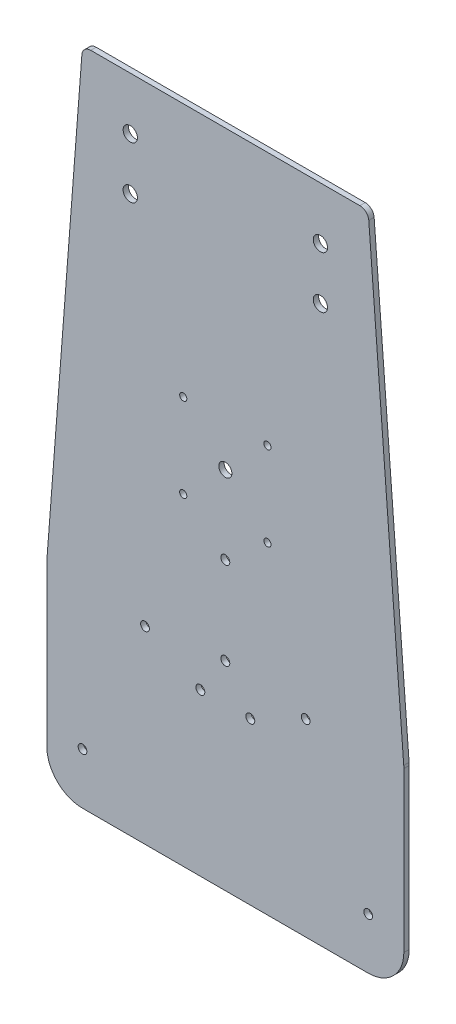
from build123d import *

# Parameters (mm, degrees)
CROQUIS1_R              = 2
CROQUIS1_R_2            = 3.675
CROQUIS1_R_3            = 2.5
CROQUIS1_R_4            = 2.45
CROQUIS1_R_5            = 4
SALIENTE_EXTRUIR1_DEPTH = 3
REDONDEO1_R             = 20
REDONDEO2_R             = 20
REDONDEO3_R             = 5


with BuildPart() as part:
    # Croquis1 → Saliente-Extruir1 (new body)
    with BuildSketch(Plane.XY):
        Polygon((-100, -204.2), (100, -204.2), (100, -94.2), (80, 165.8), (-80, 165.8), (-100, -94.2), align=None)
        with Locations((-23.57, 23.57)):
            Circle(CROQUIS1_R, mode=Mode.SUBTRACT)
        with Locations((23.57, 23.57)):
            Circle(CROQUIS1_R, mode=Mode.SUBTRACT)
        with Locations((-23.57, -23.57)):
            Circle(CROQUIS1_R, mode=Mode.SUBTRACT)
        with Locations((23.57, -23.57)):
            Circle(CROQUIS1_R, mode=Mode.SUBTRACT)
        Circle(CROQUIS1_R_2, mode=Mode.SUBTRACT)
        with Locations((-14, -113.7)):
            Circle(CROQUIS1_R_3, mode=Mode.SUBTRACT)
        with Locations(Location((14, -113.7, 0), (0, 0, 180))):
            Circle(CROQUIS1_R_3, mode=Mode.SUBTRACT)
        with Locations((-45, -98.4)):
            Circle(CROQUIS1_R_4, mode=Mode.SUBTRACT)
        with Locations(Location((45, -98.4, 0), (0, 0, 180))):
            Circle(CROQUIS1_R_4, mode=Mode.SUBTRACT)
        with Locations((-80, -175.5)):
            Circle(CROQUIS1_R_4, mode=Mode.SUBTRACT)
        with Locations(Location((80, -175.5, 0), (0, 0, 180))):
            Circle(CROQUIS1_R_4, mode=Mode.SUBTRACT)
        with Locations((0, -43.7)):
            Circle(CROQUIS1_R_3, mode=Mode.SUBTRACT)
        with Locations((0, -92.7)):
            Circle(CROQUIS1_R_3, mode=Mode.SUBTRACT)
        with Locations((53.25, 136.35)):
            Circle(CROQUIS1_R_5, mode=Mode.SUBTRACT)
        with Locations(Location((53.25, 107.25, 0), (0, 0, 180))):
            Circle(CROQUIS1_R_5, mode=Mode.SUBTRACT)
        with Locations((-53.25, 107.25)):
            Circle(CROQUIS1_R_5, mode=Mode.SUBTRACT)
        with Locations(Location((-53.25, 136.35, 0), (0, 0, 180))):
            Circle(CROQUIS1_R_5, mode=Mode.SUBTRACT)
    extrude(amount=SALIENTE_EXTRUIR1_DEPTH)

    # Redondeo1
    redondeo1_edges = [part.edges().sort_by_distance(p)[0] for p in [
        (100, -204.2, 1.5),
        (-100, -204.2, 1.5),
    ]]
    fillet(redondeo1_edges, radius=REDONDEO1_R)

    # Redondeo2
    # the kernel refuses this fillet: 20 mm, written as the material it takes off along each edge
    with BuildSketch(Plane(origin=(100, -94.2, -1.92024052), x_dir=(0, -1, 0), z_dir=(0, 0, 1))) as redondeo2_piece_1:
        with BuildLine():
            CenterArc((REDONDEO2_R * 0.0384048104053, -REDONDEO2_R), REDONDEO2_R, 90, 4.398705355)
            Line((-REDONDEO2_R * 0.0382916884794, -REDONDEO2_R * 0.00294551449842), (0, 0))
            Line((0, 0), (REDONDEO2_R * 0.0384048104053, 0))
        make_face()
    extrude(amount=6.840481041, mode=Mode.SUBTRACT)
    with BuildSketch(Plane(origin=(-100, -94.2, -1.92024052), x_dir=(0, -1, 0), z_dir=(0, 0, 1))) as redondeo2_piece_2:
        with BuildLine():
            CenterArc((REDONDEO2_R * 0.0384048104053, REDONDEO2_R), REDONDEO2_R, 265.601294645, 4.398705355)
            Line((-REDONDEO2_R * 0.0382916884794, REDONDEO2_R * 0.00294551449842), (0, 0))
            Line((0, 0), (REDONDEO2_R * 0.0384048104053, 0))
        make_face()
    extrude(amount=6.840481041, mode=Mode.SUBTRACT)

    # Redondeo3
    redondeo3_edges = [part.edges().sort_by_distance(p)[0] for p in [
        (80, 165.8, 1.5),
        (-80, 165.8, 1.5),
    ]]
    fillet(redondeo3_edges, radius=REDONDEO3_R)


solid = part.part
